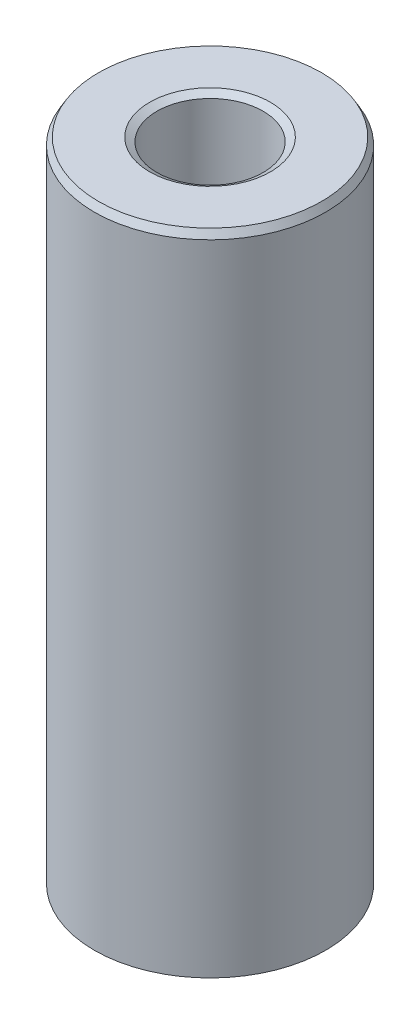
from build123d import *
from OCP.BRepFilletAPI import BRepFilletAPI_MakeChamfer

# Parameters (mm, degrees)
SKETCH1_R           = 52.5
BOSS_EXTRUDE1_DEPTH = 295.20092515
SKETCH2_R           = 24.113757383
CUT_EXTRUDE1_DEPTH  = 305.394622504
CHAMFER1_SIZE       = 3.272920605
CHAMFER1_SIZE2      = 1.889621592


with BuildPart() as part:
    # Sketch1 → Boss-Extrude1 (new body)
    with BuildSketch(Plane(origin=(0, 0, 0), x_dir=(1, 0, 0), z_dir=(0, 1, 0))):
        Circle(SKETCH1_R)
    extrude(amount=BOSS_EXTRUDE1_DEPTH)

    # Sketch2 → Cut-Extrude1 (cut, through all)
    with BuildSketch(Plane(origin=(0, 0, 0), x_dir=(1, 0, 0), z_dir=(0, 1, 0))):
        Circle(SKETCH2_R)
    extrude(amount=CUT_EXTRUDE1_DEPTH, mode=Mode.SUBTRACT)

    # Chamfer1: one chamfer whose edges measure the first distance from different faces: ONE call of the kernel's chamfer builder (chamfer() names one face for all edges)
    chamfer1_edges_1 = [part.edges().sort_by_distance(p)[0] for p in [
        (-24.113757383, 295.20092515, 0),
    ]]
    chamfer1_side_1 = [part.faces().sort_by_distance(p)[0] for p in [
        (-51.01507576, 295.20092515, 0),
    ]]
    chamfer1_edges_2 = [part.edges().sort_by_distance(p)[0] for p in [
        (-24.113757383, 0, 0),
    ]]
    chamfer1_side_2 = [part.faces().sort_by_distance(p)[0] for p in [
        (-24.113757383, 147.600462575, 0),
    ]]
    chamfer1_edges_3 = [part.edges().sort_by_distance(p)[0] for p in [
        (-52.5, 0, 0),
    ]]
    chamfer1_side_3 = [part.faces().sort_by_distance(p)[0] for p in [
        (-51.01507576, 0, 0),
    ]]
    chamfer1_edges_4 = [part.edges().sort_by_distance(p)[0] for p in [
        (-52.5, 295.20092515, 0),
    ]]
    chamfer1_side_4 = [part.faces().sort_by_distance(p)[0] for p in [
        (-52.5, 147.600462575, 0),
    ]]
    chamfer1 = BRepFilletAPI_MakeChamfer(part.part.solid().wrapped)
    for e in chamfer1_edges_1:
        chamfer1.Add(CHAMFER1_SIZE, CHAMFER1_SIZE2, e.wrapped, chamfer1_side_1[0].wrapped)  # the first distance lies on this face
    for e in chamfer1_edges_2:
        chamfer1.Add(CHAMFER1_SIZE, CHAMFER1_SIZE2, e.wrapped, chamfer1_side_2[0].wrapped)  # the first distance lies on this face
    for e in chamfer1_edges_3:
        chamfer1.Add(CHAMFER1_SIZE, CHAMFER1_SIZE2, e.wrapped, chamfer1_side_3[0].wrapped)  # the first distance lies on this face
    for e in chamfer1_edges_4:
        chamfer1.Add(CHAMFER1_SIZE, CHAMFER1_SIZE2, e.wrapped, chamfer1_side_4[0].wrapped)  # the first distance lies on this face
    add(Compound.cast(chamfer1.Shape()), mode=Mode.REPLACE)


solid = part.part
